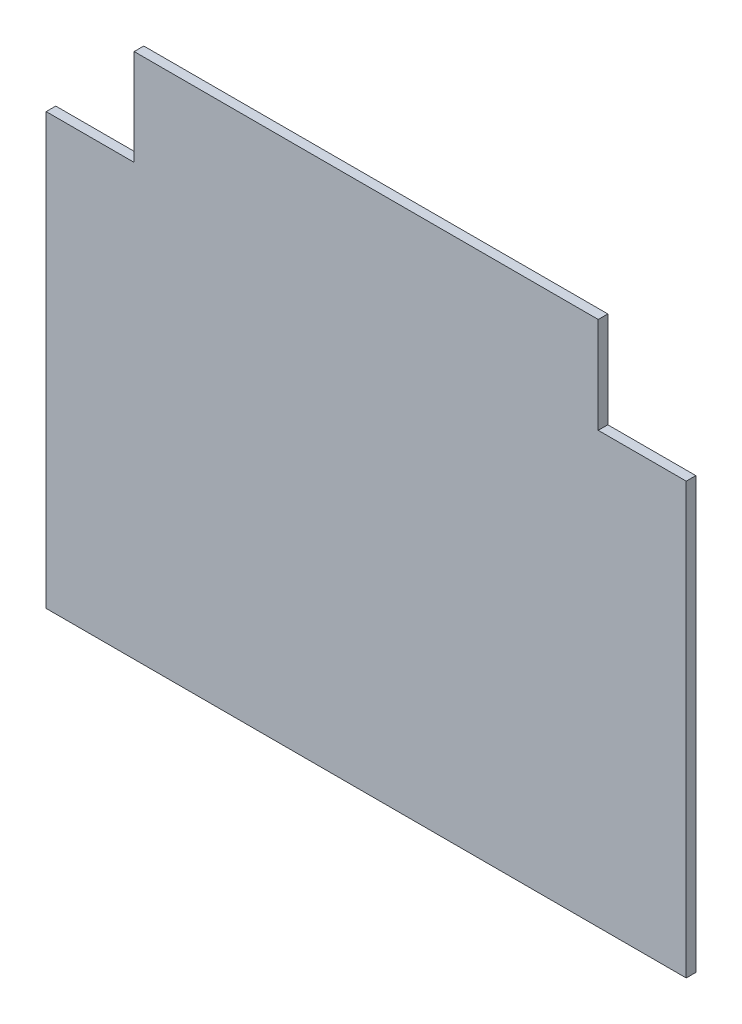
from build123d import *

# Parameters (mm, degrees)
SKETCH1_W           = 400
SKETCH1_H           = 328.91
BOSS_EXTRUDE1_DEPTH = 6
SKETCH2_W           = 55
SKETCH2_H           = 60
CUT_EXTRUDE1_DEPTH  = 40


with BuildPart() as part:
    # Sketch1 → Boss-Extrude1 (new body)
    with BuildSketch(Plane.XY):
        with Locations((89.131383381, 155.121802076)):
            Rectangle(SKETCH1_W, SKETCH1_H)
    extrude(amount=BOSS_EXTRUDE1_DEPTH)

    # Sketch2 → Cut-Extrude1 (cut)
    with BuildSketch(Plane(origin=(0, 0, 0), x_dir=(-1, 0, 0), z_dir=(0, 0, -1))):
        with Locations((-261.631383381, 289.576802076)):
            Rectangle(SKETCH2_W, SKETCH2_H)
        with Locations((83.368616619, 289.576802076)):
            Rectangle(SKETCH2_W, SKETCH2_H)
    extrude(amount=-CUT_EXTRUDE1_DEPTH, mode=Mode.SUBTRACT)


solid = part.part
